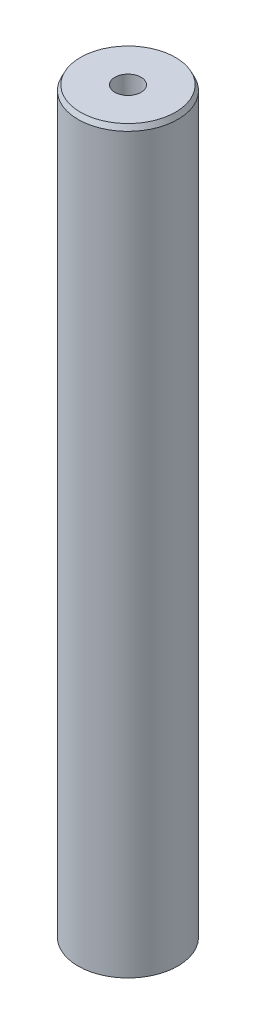
from build123d import *
from OCP.BRepFilletAPI import BRepFilletAPI_MakeChamfer

# Parameters (mm, degrees)
SKETCH1_R           = 12.5
BOSS_EXTRUDE1_DEPTH = 185.4904758
SKETCH2_R           = 3.282260691
CUT_EXTRUDE1_DEPTH  = 187.330933053
CHAMFER1_SIZE       = 1.260983722
CHAMFER1_SIZE2      = 0.602767817


with BuildPart() as part:
    # Sketch1 → Boss-Extrude1 (new body)
    with BuildSketch(Plane(origin=(0, 0, 0), x_dir=(1, 0, 0), z_dir=(0, 1, 0))):
        Circle(SKETCH1_R)
    extrude(amount=BOSS_EXTRUDE1_DEPTH)

    # Sketch2 → Cut-Extrude1 (cut, through all)
    with BuildSketch(Plane(origin=(0, 0, 0), x_dir=(1, 0, 0), z_dir=(0, 1, 0))):
        Circle(SKETCH2_R)
    extrude(amount=CUT_EXTRUDE1_DEPTH, mode=Mode.SUBTRACT)

    # Chamfer1: one chamfer whose edges measure the first distance from different faces: ONE call of the kernel's chamfer builder (chamfer() names one face for all edges)
    chamfer1_edges_1 = [part.edges().sort_by_distance(p)[0] for p in [
        (-12.5, 185.4904758, 0),
    ]]
    chamfer1_side_1 = [part.faces().sort_by_distance(p)[0] for p in [
        (-12.5, 92.7452379, 0),
    ]]
    chamfer1_edges_2 = [part.edges().sort_by_distance(p)[0] for p in [
        (-12.5, 0, 0),
    ]]
    chamfer1_side_2 = [part.faces().sort_by_distance(p)[0] for p in [
        (-12.146446609, 0, 0),
    ]]
    chamfer1 = BRepFilletAPI_MakeChamfer(part.part.solid().wrapped)
    for e in chamfer1_edges_1:
        chamfer1.Add(CHAMFER1_SIZE, CHAMFER1_SIZE2, e.wrapped, chamfer1_side_1[0].wrapped)  # the first distance lies on this face
    for e in chamfer1_edges_2:
        chamfer1.Add(CHAMFER1_SIZE, CHAMFER1_SIZE2, e.wrapped, chamfer1_side_2[0].wrapped)  # the first distance lies on this face
    add(Compound.cast(chamfer1.Shape()), mode=Mode.REPLACE)


solid = part.part
